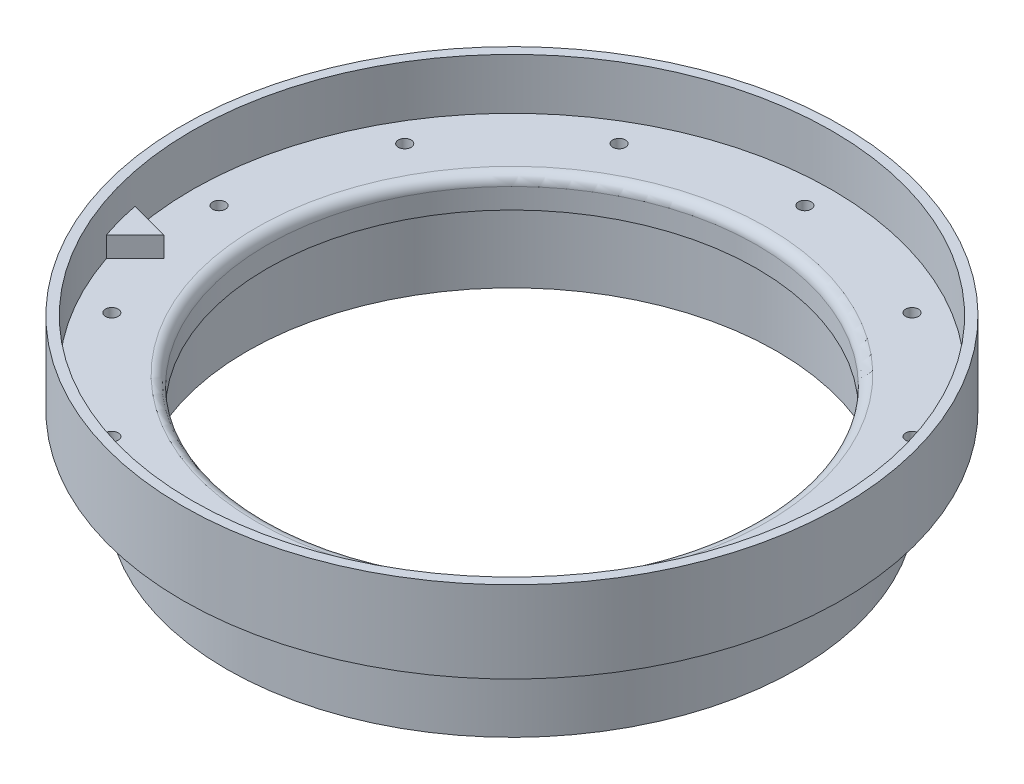
from build123d import *

# Parameters (mm, degrees)
F_3_48_TAPPED_HOLE1_D = 1.9939
CIRPATTERN1_COUNT     = 12
BOSS_EXTRUDE1_DEPTH   = 3.175


with BuildPart() as part:
    # Cross Section → Main (revolve)
    with BuildSketch(Plane.XY):
        with BuildLine():
            Line((-38.1, 0), (-38.1, -3.175))
            Line((-38.1, -3.175), (-41.2242, -3.175))
            Line((-41.2242, -3.175), (-41.2242, -15.875))
            Line((-41.2242, -15.875), (-44.3992, -15.875))
            Line((-44.3992, -15.875), (-44.3992, -3.175))
            Line((-44.3992, -3.175), (-51.2572, -3.175))
            Line((-51.2572, -3.175), (-51.2572, 9.525))
            Line((-51.2572, 9.525), (-49.784, 9.525))
            Line((-49.784, 9.525), (-49.784, 1.5875))
            Line((-49.784, 1.5875), (-39.6875, 1.5875))
            ThreePointArc((-39.6875, 1.5875), (-38.564967985, 1.122532015), (-38.1, 0))
        make_face()
    revolve(axis=Axis((0, 55, 0), (0, -1, 0)))

    # #3-48 Tapped Hole1 (through all)
    with Locations(Plane(origin=(0, 1.5875, 0), x_dir=(1, 0, 0), z_dir=(0, 1, 0))):
        with Locations((-45.5549, 0)):
            f_3_48_tapped_hole1 = Hole(F_3_48_TAPPED_HOLE1_D / 2)

    # CirPattern1: #3-48 Tapped Hole1 ×12 about axis
    cirpattern1_axis = Axis((0, 0, 0), (0, -1, 0))
    for i in range(1, CIRPATTERN1_COUNT):
        add(f_3_48_tapped_hole1.rotate(cirpattern1_axis, i * 360 / CIRPATTERN1_COUNT), mode=Mode.SUBTRACT)

    # Sketch3 → Boss-Extrude1 (add)
    with BuildSketch(Plane(origin=(0, 1.5875, 0), x_dir=(1, 0, 0), z_dir=(0, 1, 0))):
        with BuildLine():
            Line((-47.168007396, -15.925631363), (-42.677879335, -11.435503303))
            Line((-42.677879335, -11.435503303), (-48.811508332, -9.792002366))
            ThreePointArc((-48.811508332, -9.792002366), (-48.087651336, -12.885047341), (-47.168007396, -15.925631363))
        make_face()
    extrude(amount=BOSS_EXTRUDE1_DEPTH)


solid = part.part
